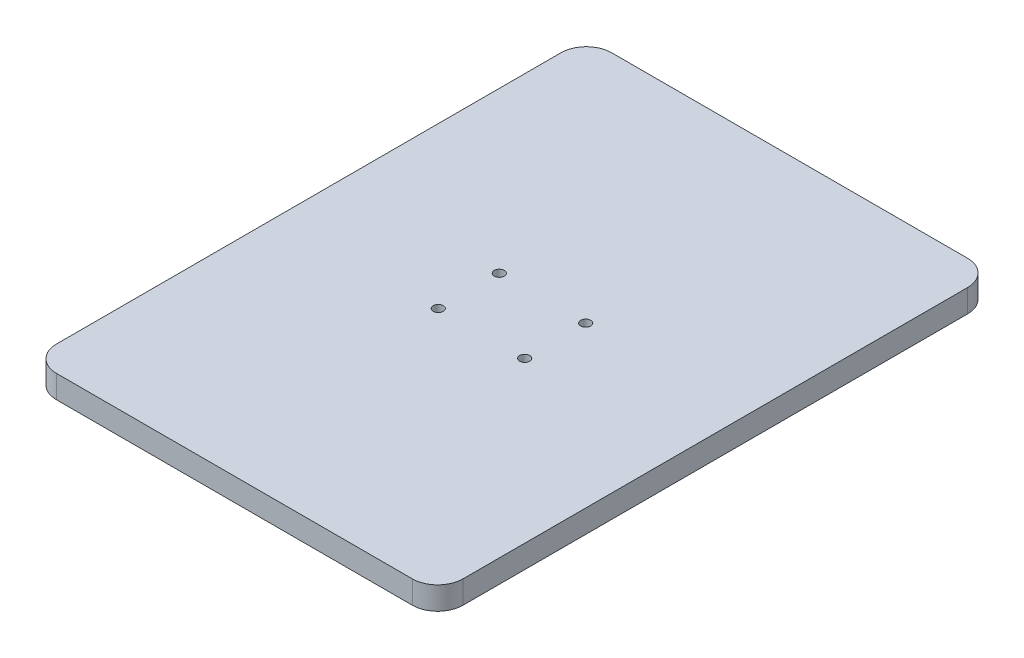
from build123d import *

# Parameters (mm, degrees)
SKETCH1_R           = 1.25
BOSS_EXTRUDE1_DEPTH = 5.715


with BuildPart() as part:
    # Sketch1 → Boss-Extrude1 (new body)
    with BuildSketch(Plane(origin=(0, 27.05, 0), x_dir=(1, 0, 0), z_dir=(0, 1, 0))):
        with BuildLine():
            Line((-44.45, -69.369872981), (44.45, -69.369872981))
            ThreePointArc((44.45, -69.369872981), (48.940128061, -67.510001042), (50.8, -63.019872981))
            Line((50.8, -63.019872981), (50.8, 63.019872981))
            ThreePointArc((50.8, 63.019872981), (48.940128061, 67.510001042), (44.45, 69.369872981))
            Line((44.45, 69.369872981), (-44.45, 69.369872981))
            ThreePointArc((-44.45, 69.369872981), (-48.940128061, 67.510001042), (-50.8, 63.019872981))
            Line((-50.8, 63.019872981), (-50.8, -63.019872981))
            ThreePointArc((-50.8, -63.019872981), (-48.940128061, -67.510001042), (-44.45, -69.369872981))
        make_face()
        with Locations((10.795, 7.62)):
            Circle(SKETCH1_R, mode=Mode.SUBTRACT)
        with Locations((10.795, -7.62)):
            Circle(SKETCH1_R, mode=Mode.SUBTRACT)
        with Locations((-10.795, -7.62)):
            Circle(SKETCH1_R, mode=Mode.SUBTRACT)
        with Locations((-10.795, 7.62)):
            Circle(SKETCH1_R, mode=Mode.SUBTRACT)
    extrude(amount=BOSS_EXTRUDE1_DEPTH)


solid = part.part
